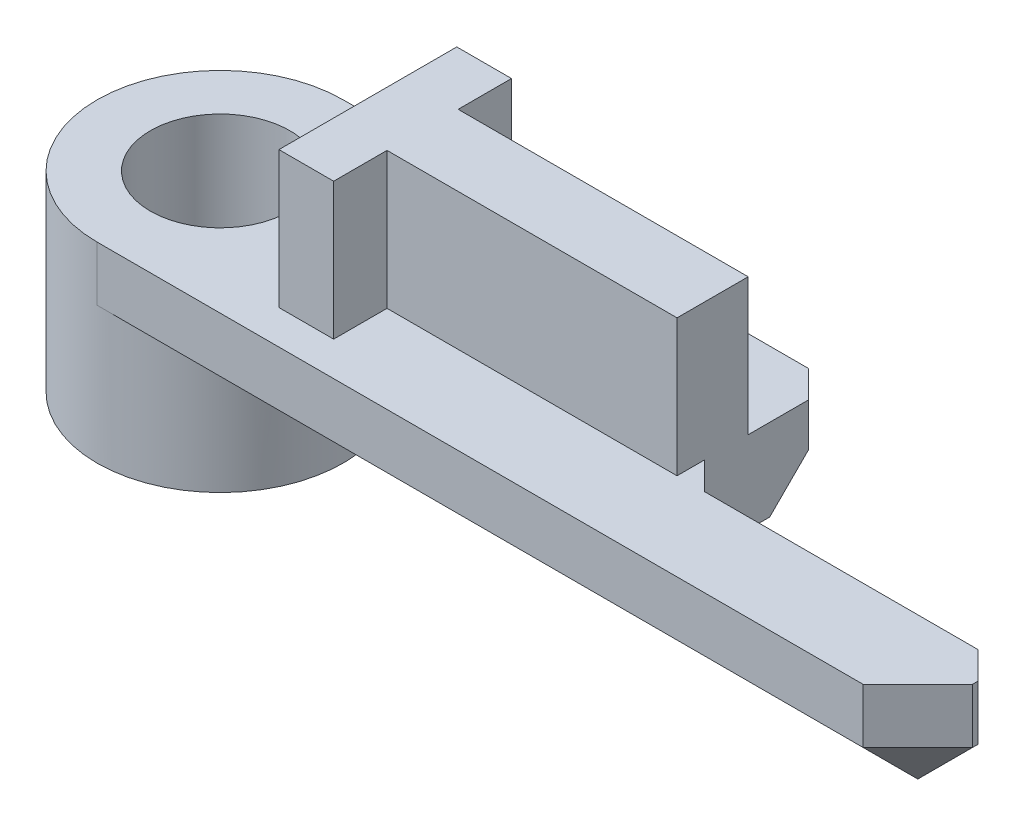
from build123d import *

# Parameters (mm, degrees)
SKETCH1_R           = 4.5
SKETCH1_R_2         = 2.55
BOSS_EXTRUDE1_DEPTH = 3
SKETCH2_R           = 2.55
BOSS_EXTRUDE2_DEPTH = 4
CHAMFER1_SIZE       = 2
CUT_EXTRUDE1_DEPTH  = 32.132780152
BOSS_EXTRUDE4_DEPTH = 5
CHAMFER2_SIZE       = 1


with BuildPart() as part:
    # Sketch1 → Boss-Extrude1 (new body)
    with BuildSketch(Plane(origin=(0, 0, 0), x_dir=(1, 0, 0), z_dir=(0, 1, 0))):
        with Locations(Location((0, 0, 0), (0, 0, 270))):
            Circle(SKETCH1_R)
        with Locations(Location((0, 0, 0), (0, 0, 270))):
            Circle(SKETCH1_R_2, mode=Mode.SUBTRACT)
    extrude(amount=BOSS_EXTRUDE1_DEPTH)

    # Sketch2 → Boss-Extrude2 (add)
    with BuildSketch(Plane(origin=(0, 3, 0), x_dir=(1, 0, 0), z_dir=(0, 1, 0))):
        with BuildLine():
            Line((0, -4.5), (30, -4.5))
            Line((30, -4.5), (30, 4.5))
            Line((30, 4.5), (0, 4.5))
            ThreePointArc((0, 4.5), (-4.5, 0), (0, -4.5))
        make_face()
        with Locations(Location((0, 0, 0), (0, 0, 270))):
            Circle(SKETCH2_R, mode=Mode.SUBTRACT)
    extrude(amount=BOSS_EXTRUDE2_DEPTH)

    # Chamfer1
    # the kernel refuses this chamfer: 2 mm, written as the material it takes off along each edge
    with BuildSketch(Plane(origin=(28.666666667, 4.333333333, 3.166666667), x_dir=(-0.7071067811865475, -0.7071067811865475, 0), z_dir=(0.5773502691896256, -0.5773502691896258, 0.5773502691896258))) as chamfer1_piece_1:
        Polygon((-1.414213562, 0.816496581), (1.414213562, 0.816496581), (0, -1.632993162), align=None)
    extrude(amount=2.540341184, mode=Mode.SUBTRACT)
    with BuildSketch(Plane(origin=(28.666666667, 4.333333333, -3.166666667), x_dir=(-0.7071067811865476, -0.7071067811865475, 0), z_dir=(0.5773502691896256, -0.5773502691896258, -0.5773502691896257))) as chamfer1_piece_2:
        Polygon((-1.414213562, -0.816496581), (1.414213562, -0.816496581), (0, 1.632993162), align=None)
    extrude(amount=2.540341184, mode=Mode.SUBTRACT)
    with BuildSketch(Plane(origin=(-5.143365976, 3, 4.5), x_dir=(0, -0.027495876610586275, -0.9996219169112968), z_dir=(1, 0, 0))) as chamfer1_piece_3_section:
        Polygon((CHAMFER1_SIZE * 0.999621916911, CHAMFER1_SIZE * 0.0274958766106), (-CHAMFER1_SIZE * 0.0274958766106, CHAMFER1_SIZE * 0.999621916911), (0, 0), align=None)
    chamfer1_piece_3 = extrude(amount=40.286731952, mode=Mode.PRIVATE)
    chamfer1_piece_3 = chamfer1_piece_3 - Plane(origin=(0, 3.673505516, 0), x_dir=(0, 0, 1), z_dir=(0, -1, 0)) * Cylinder(4.5, 89, mode=Mode.PRIVATE)
    add(chamfer1_piece_3, mode=Mode.SUBTRACT)
    with BuildSketch(Plane(origin=(30, 3, 9.643365976), x_dir=(-0.9996219169112968, -0.027495876610586296, 0), z_dir=(0, 0, -1))) as chamfer1_piece_4:
        Polygon((CHAMFER1_SIZE * 0.999621916911, CHAMFER1_SIZE * 0.0274958766106), (-CHAMFER1_SIZE * 0.0274958766106, CHAMFER1_SIZE * 0.999621916911), (0, 0), align=None)
    extrude(amount=19.286731952, mode=Mode.SUBTRACT)
    with BuildSketch(Plane(origin=(30, -2.143365976, 4.5), x_dir=(-0.9996219169112968, 0, 0.02749587661058651), z_dir=(0, 1, 0))) as chamfer1_piece_5:
        Polygon((CHAMFER1_SIZE * 0.999621916911, -CHAMFER1_SIZE * 0.0274958766106), (-CHAMFER1_SIZE * 0.0274958766106, -CHAMFER1_SIZE * 0.999621916911), (0, 0), align=None)
    extrude(amount=14.286731952, mode=Mode.SUBTRACT)
    with BuildSketch(Plane(origin=(35.143365976, 3, -4.5), x_dir=(0, -0.027495876610586275, 0.9996219169112968), z_dir=(-1, 0, 0))) as chamfer1_piece_6_section:
        Polygon((CHAMFER1_SIZE * 0.999621916911, CHAMFER1_SIZE * 0.0274958766106), (-CHAMFER1_SIZE * 0.0274958766106, CHAMFER1_SIZE * 0.999621916911), (0, 0), align=None)
    chamfer1_piece_6 = extrude(amount=40.286731952, mode=Mode.PRIVATE)
    chamfer1_piece_6 = chamfer1_piece_6 - Plane(origin=(0, 3.673505518, 0), x_dir=(0, 0, 1), z_dir=(0, -1, 0)) * Cylinder(4.5, 89, mode=Mode.PRIVATE)
    add(chamfer1_piece_6, mode=Mode.SUBTRACT)
    with BuildSketch(Plane(origin=(30, -2.143365976, -4.5), x_dir=(-0.9996219169112968, 0, -0.02749587661058651), z_dir=(0, 1, 0))) as chamfer1_piece_7:
        Polygon((CHAMFER1_SIZE * 0.999621916911, CHAMFER1_SIZE * 0.0274958766106), (-CHAMFER1_SIZE * 0.0274958766106, CHAMFER1_SIZE * 0.999621916911), (0, 0), align=None)
    extrude(amount=14.286731952, mode=Mode.SUBTRACT)

    # Sketch3 → Cut-Extrude1 (cut, through all)
    with BuildSketch(Plane(origin=(0, 7, 0), x_dir=(1, 0, 0), z_dir=(0, 1, 0))):
        Polygon((18, 1.3), (18, -1.3), (30, -1.3), (30, 2.5), (28, 4.5), (18, 4.5), align=None)
    extrude(amount=-CUT_EXTRUDE1_DEPTH, mode=Mode.SUBTRACT)

    # Sketch3<4> → Boss-Extrude4 (add)
    with BuildSketch(Plane(origin=(0, 7, 0), x_dir=(1, 0, 0), z_dir=(0, 1, 0))):
        Polygon((5.4, 3.25), (5.4, -3.25), (7.4, -3.25), (7.4, -1.3), (18, -1.3), (18, 1.3), (7.4, 1.3), (7.4, 3.25), align=None)
    extrude(amount=BOSS_EXTRUDE4_DEPTH)

    # Chamfer2
    chamfer2_edges = [part.edges().sort_by_distance(p)[0] for p in [
        (29, 4, 1.3),
        (18, 4, -3.5),
        (18, 5, 1.3),
        (30, 6, 1.3),
        (23, 3, 1.3),
        (18, 3, -0.6),
        (18, 6, -4.5),
    ]]
    chamfer(chamfer2_edges, length=CHAMFER2_SIZE)


solid = part.part
